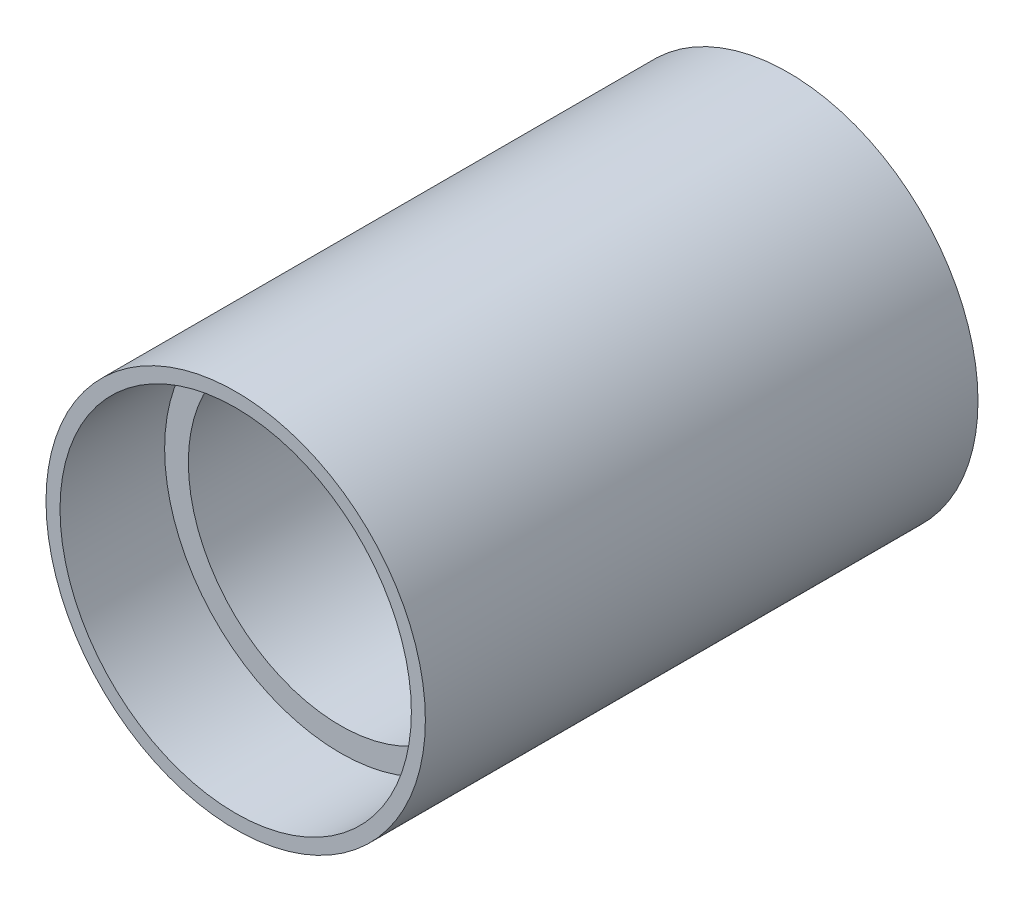
from build123d import *

# Parameters (mm, degrees)
PROFILE_SKETCH_R           = 12.7
PROFILE_EXTRUDE_DEPTH      = 37
BORE_SKETCH_R              = 10.1745034
BORE_CUT_DEPTH             = 42.128822011
BEARING_POCKET_1_SKETCH_R  = 11.7620034
BEARING_POCKET_1_CUT_DEPTH = 7.0049898
BEARING_START              = -7.0049898
BEARING_POCKET_2_SKETCH_R  = 11.7620034
BEARING_POCKET_2_CUT_DEPTH = 7.0049898


with BuildPart() as part:
    # Profile Sketch → Profile Extrude (new body)
    with BuildSketch(Plane.XY):
        Circle(PROFILE_SKETCH_R)
    extrude(amount=PROFILE_EXTRUDE_DEPTH)

    # Bore Sketch → Bore Cut (cut, through all)
    with BuildSketch(Plane(origin=(0, 0, 0), x_dir=(-1, 0, 0), z_dir=(0, 0, -1))):
        Circle(BORE_SKETCH_R)
    extrude(amount=-BORE_CUT_DEPTH, mode=Mode.SUBTRACT)

    # Bearing Pocket 1 Sketch → Bearing Pocket 1 Cut (cut)
    with BuildSketch(Plane(origin=(0, 0, 0), x_dir=(-1, 0, 0), z_dir=(0, 0, -1))):
        Circle(BEARING_POCKET_1_SKETCH_R)
    extrude(amount=-BEARING_POCKET_1_CUT_DEPTH, mode=Mode.SUBTRACT)

    # Bearing Pocket 2 Sketch → Bearing Pocket 2 Cut (cut)
    with BuildSketch(Plane.XY.offset(37).offset(BEARING_START)):
        Circle(BEARING_POCKET_2_SKETCH_R)
    extrude(amount=BEARING_POCKET_2_CUT_DEPTH, mode=Mode.SUBTRACT)


solid = part.part
